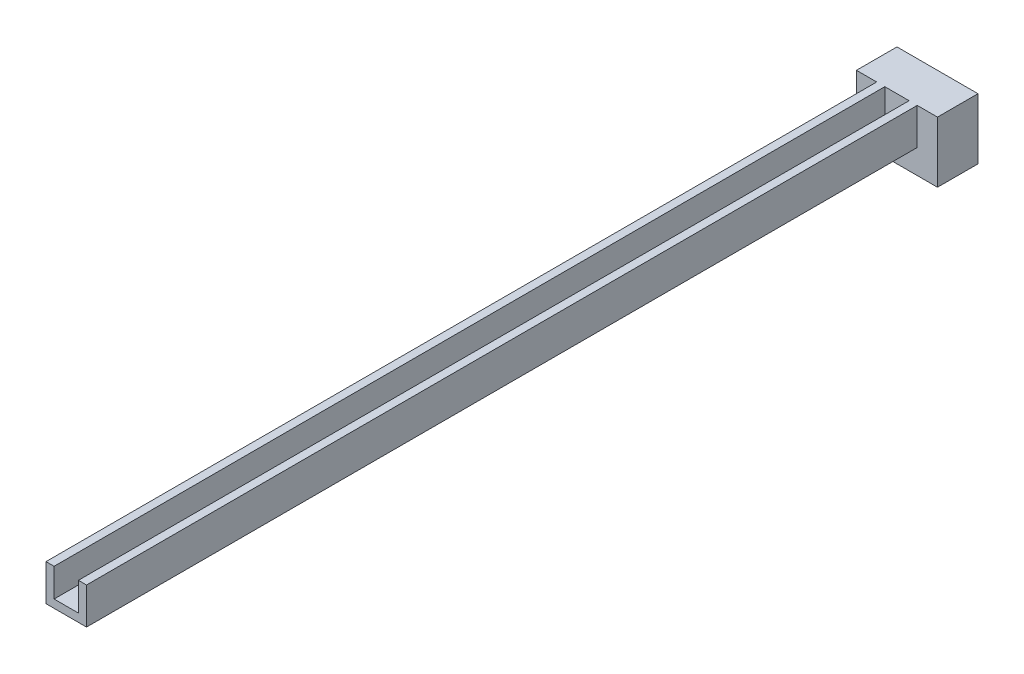
from build123d import *

# Parameters (mm, degrees)
EXTRUDE_1_DEPTH          = 245
SKETCH_2_R               = 2.5
CUT_EXTRUDE_1_DEPTH      = 246.21623111
CUT_EXTRUDE_2_DEPTH      = 246.21623111
CUT_EXTRUDE_2_DEPTH_BACK = 246.21623111
SKETCH_3_W               = 10
SKETCH_3_H               = 40
SKETCH_5_W               = 20
SKETCH_5_H               = 15
EXTRUDE_3_DEPTH          = 10


with BuildPart() as part:
    # ｽｹｯﾁ1 → ﾎﾞｽ - 押し出し1 (new body)
    with BuildSketch(Plane.XY):
        Polygon((-5, 9), (-5, 0), (5, 0), (5, 9), (3, 9), (3, 2), (-3, 2), (-3, 9), align=None)
    extrude(amount=EXTRUDE_1_DEPTH)

    # ｽｹｯﾁ2 → ｶｯﾄ - 押し出し1 (cut, through all)
    with BuildSketch(Plane.XZ):
        with Locations((0, 225)):
            Circle(SKETCH_2_R)
        with Locations((0, 217)):
            Circle(SKETCH_2_R)
        with Locations((0, 122.5)):
            Circle(SKETCH_2_R)
        with Locations((0, 209)):
            Circle(SKETCH_2_R)
        with Locations((0, 193)):
            Circle(SKETCH_2_R)
        with Locations((0, 161)):
            Circle(SKETCH_2_R)
    cut_extrude_1 = extrude(amount=-CUT_EXTRUDE_1_DEPTH, mode=Mode.SUBTRACT)

    # ﾐﾗｰ1: ｶｯﾄ - 押し出し1 across plane
    add(cut_extrude_1.mirror(Plane.XY.offset(122.5)), mode=Mode.SUBTRACT)

    # ｽｹｯﾁ3 → ｶｯﾄ - 押し出し2 (cut, two sides: drawn at the far end of the back side and taken through both)
    with BuildSketch(Plane.XZ.offset(-CUT_EXTRUDE_2_DEPTH_BACK)):
        with Locations((0, 20)):
            Rectangle(SKETCH_3_W, SKETCH_3_H)
    extrude(amount=CUT_EXTRUDE_2_DEPTH + CUT_EXTRUDE_2_DEPTH_BACK, mode=Mode.SUBTRACT)

    # ｽｹｯﾁ5 → ﾎﾞｽ - 押し出し3 (add)
    with BuildSketch(Plane(origin=(0, 0, 40), x_dir=(-1, 0, 0), z_dir=(0, 0, -1))):
        with Locations((0, 1.5)):
            Rectangle(SKETCH_5_W, SKETCH_5_H)
    extrude(amount=EXTRUDE_3_DEPTH)


solid = part.part
